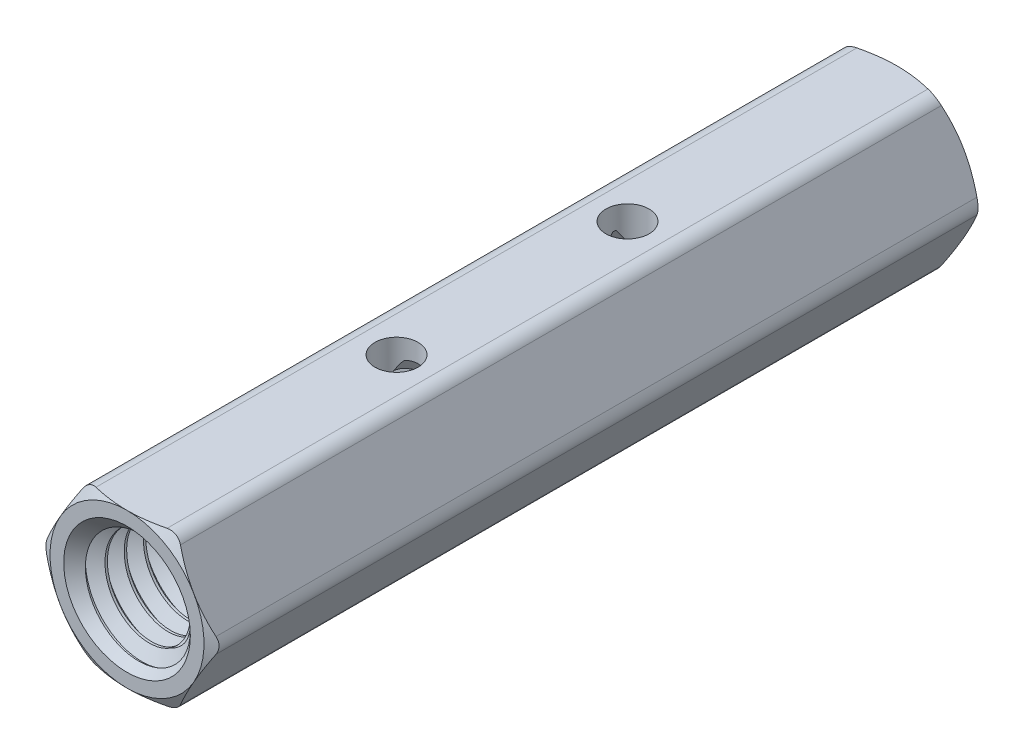
from build123d import *

# Parameters (mm, degrees)
SKETCH4_R                      = 2.794
BOSS_EXTRUDE1_DEPTH            = 15.875
SKETCH5_OUTSIDE_W              = 130.696
SKETCH5_OUTSIDE_H              = 129.714
SKETCH5_OUTSIDE_R              = 3.175
CUT_EXTRUDE1_DEPTH             = 33.11828075
CUT_EXTRUDE1_DRAFT             = -60
SKETCH6_OUTSIDE_W              = 130.696
SKETCH6_OUTSIDE_H              = 129.714
SKETCH6_OUTSIDE_R              = 3.175
CUT_EXTRUDE2_DEPTH             = 33.11828075
CUT_EXTRUDE2_DRAFT             = -60
FILLET1_R                      = 0.635
BOSS_EXTRUDE2_START            = -12.7
SKETCH7_R                      = 2.6114375
BOSS_EXTRUDE2_DEPTH            = 12.7
SKETCH8_W                      = 12.7
SKETCH8_H                      = 2.413
CUT_SWEEP1_PITCH               = 0.79375
CUT_SWEEP1_TO                  = 12.7
CIRPATTERN1_COUNT              = 2
SKETCH13_W                     = 0.889
SKETCH13_H                     = 3.175
F_0_CLEARANCE_HOLE1_AT_2_COUNT = 2
F_0_CLEARANCE_HOLE1_AT_2_PITCH = 9.525


with BuildPart() as part:
    # Sketch3 → Revolve1 (revolve)
    with BuildSketch(Plane(origin=(0, 0, 0), x_dir=(0, 0, -1), z_dir=(1, 0, 0))):
        Polygon((-15.6765625, 2.413), (-3.175, 2.413), (-3.175, 0), (3.175, 0), (3.175, 2.413), (15.875, 2.413), (15.875, 3.175), (0, 3.175), (-15.875, 3.175), (-15.875, 2.6114375), align=None)
        Polygon((-15.6765625, 2.413), (-3.175, 2.413), (-3.175, 0), (3.175, 0), (3.175, 2.413), (15.875, 2.413), (15.875, 3.175), (0, 3.175), (-15.875, 3.175), (-15.875, 2.6114375), align=None)
    revolve(axis=Axis((0, 0, 3.175), (0, 0, 1)))

    # Sketch4 → Boss-Extrude1 (add, symmetric)
    with BuildSketch(Plane.XY):
        Polygon((-1.833087105, 3.175), (-3.666174209, 0), (-1.833087105, -3.175), (1.833087105, -3.175), (3.666174209, 0), (1.833087105, 3.175), align=None)
        Circle(SKETCH4_R, mode=Mode.SUBTRACT)
    extrude(amount=BOSS_EXTRUDE1_DEPTH, both=True)


with BuildPart() as cut_extrude1_tool:
    # Sketch5 outside → Cut-Extrude1 (with draft: the straight prism first)
    with BuildSketch(Plane.XY.offset(15.875)):
        Rectangle(SKETCH5_OUTSIDE_W, SKETCH5_OUTSIDE_H)
        Circle(SKETCH5_OUTSIDE_R, mode=Mode.SUBTRACT)
    extrude(amount=-CUT_EXTRUDE1_DEPTH)
    # Cut-Extrude1: the draft: its side faces are tilted about the plane it starts from
    cut_extrude1_sides = [cut_extrude1_tool.faces().sort_by_distance(p)[0] for p in [
        (0, -64.857, -0.684140375),
        (65.348, 0, -0.684140375),
        (0, 64.857, -0.684140375),
        (-65.348, 0, -0.684140375),
        (-3.175, 0, -0.684140375),
    ]]
    draft(cut_extrude1_sides, Plane.XY.offset(15.875), CUT_EXTRUDE1_DRAFT)


with BuildPart() as part_1:
    add(part.part)

    # Cut-Extrude1: cut by cut_extrude1_tool
    add(cut_extrude1_tool.part, mode=Mode.SUBTRACT)


with BuildPart() as cut_extrude2_tool:
    # Sketch6 outside → Cut-Extrude2 (with draft: the straight prism first)
    with BuildSketch(Plane(origin=(0, 0, -15.875), x_dir=(-1, 0, 0), z_dir=(0, 0, -1))):
        Rectangle(SKETCH6_OUTSIDE_W, SKETCH6_OUTSIDE_H)
        Circle(SKETCH6_OUTSIDE_R, mode=Mode.SUBTRACT)
    extrude(amount=-CUT_EXTRUDE2_DEPTH)
    # Cut-Extrude2: the draft: its side faces are tilted about the plane it starts from
    cut_extrude2_sides = [cut_extrude2_tool.faces().sort_by_distance(p)[0] for p in [
        (0, -64.857, 0.684140375),
        (-65.348, 0, 0.684140375),
        (0, 64.857, 0.684140375),
        (65.348, 0, 0.684140375),
        (3.175, 0, 0.684140375),
    ]]
    draft(cut_extrude2_sides, Plane(origin=(0, 0, -15.875), x_dir=(-1, 0, 0), z_dir=(0, 0, -1)), CUT_EXTRUDE2_DRAFT)


with BuildPart() as part_2:
    add(part_1.part)

    # Cut-Extrude2: cut by cut_extrude2_tool
    add(cut_extrude2_tool.part, mode=Mode.SUBTRACT)

    # Fillet1
    fillet1_edges = [part_2.edges().sort_by_distance(p)[0] for p in [
        (1.833087105, 3.175, 0),
        (-3.666174209, 0, 0),
        (-1.833087105, -3.175, 0),
        (1.833087105, -3.175, 0),
        (3.666174209, 0, 0),
        (-1.833087105, 3.175, 0),
    ]]
    fillet(fillet1_edges, radius=FILLET1_R)

    # Split1
    split(bisect_by=Plane.XY, keep=Keep.TOP)

    # Sketch7 → Boss-Extrude2 (add)
    with BuildSketch(Plane(origin=(0, 0, 3.175), x_dir=(-1, 0, 0), z_dir=(0, 0, -1)).offset(BOSS_EXTRUDE2_START)):
        Circle(SKETCH7_R)
    extrude(amount=BOSS_EXTRUDE2_DEPTH)


with BuildPart() as body_2:
    # Sketch8 → Revolve2 (revolve)
    with BuildSketch(Plane(origin=(0, 0, 0), x_dir=(0, 0, -1), z_dir=(1, 0, 0))):
        with Locations((-9.525, 1.2065)):
            Rectangle(SKETCH8_W, SKETCH8_H)
    revolve(axis=Axis((0, 0, 3.175), (0, 0, 1)))

    # Cut-Sweep1: arcs per turn and ends read off the stored shape
    # Cut-Sweep1: the profile of Sketch10 screwed along a right-hand helix through 18 turns, 8 arcs to a turn; built about Z, then put on its axis
    cut_sweep1_z = Axis((0, 0, 0), (0, 0, 1))
    cut_sweep1_corners = [(1.897444252, 0, -1.190625), (1.897444252, 0, -1.09140625), (2.455962979, 0, -0.768945313), (2.455962979, 0, -1.513085938)]
    with BuildLine(mode=Mode.PRIVATE) as cut_sweep1_profile:
        Line(cut_sweep1_corners[0], cut_sweep1_corners[1])
        Line(cut_sweep1_corners[1], cut_sweep1_corners[2])
        Line(cut_sweep1_corners[2], cut_sweep1_corners[3])
        Line(cut_sweep1_corners[3], cut_sweep1_corners[0])
    cut_sweep1_cap = Face(cut_sweep1_profile.wire())
    cut_sweep1_turn_angles = [0, 22.5, 45, 67.5, 90, 112.5, 135, 157.5, 180, 202.5, 225, 247.5, 270, 292.5, 315, 337.5, 360]
    cut_sweep1_turn_weights = [1, 0.9238795325112867, 1, 0.9238795325112867, 1, 0.9238795325112867, 1, 0.9238795325112867, 1, 0.9238795325112867, 1, 0.9238795325112867, 1, 0.9238795325112867, 1, 0.9238795325112867, 1]
    cut_sweep1_turn_rails = [Edge.make_bspline([Vector(p[0], p[1], 0).rotate(cut_sweep1_z, cut_sweep1_turn_angles[k]) / cut_sweep1_turn_weights[k] + Vector(0, 0, p[2] + CUT_SWEEP1_PITCH * cut_sweep1_turn_angles[k] / 360) for k in range(17)], [0, 0, 0, 1, 1, 2, 2, 3, 3, 4, 4, 5, 5, 6, 6, 7, 7, 8, 8, 8], 2, cut_sweep1_turn_weights) for p in cut_sweep1_corners]
    cut_sweep1_turn_sides = [Face.make_surface_from_curves(cut_sweep1_turn_rails[p[0]], cut_sweep1_turn_rails[p[1]]) for p in [(0, 1), (1, 2), (2, 3), (3, 0)]]
    cut_sweep1 = Plane(origin=(0, 0, 15.875), x_dir=(0, 1, 0), z_dir=(0, 0, -1)) * split(Solid(Shell([*[p.moved(Location((0, 0, CUT_SWEEP1_PITCH * i))) for i in range(18) for p in cut_sweep1_turn_sides], cut_sweep1_cap, cut_sweep1_cap.rotate(cut_sweep1_z, 6480).moved(Location((0, 0, CUT_SWEEP1_PITCH * 6480 / 360)))])), bisect_by=Plane.XY.offset(CUT_SWEEP1_TO), keep=Keep.BOTTOM, mode=Mode.PRIVATE)
    add(cut_sweep1, mode=Mode.SUBTRACT)


with BuildPart() as part_3:
    add(part_2.part)

    # Combine1: cut body 2
    add(body_2.part, mode=Mode.SUBTRACT)

    # Cut-Extrude3 cone 1 section (through the dimple's axis) → Cut-Extrude3 (revolve, cut)
    with BuildSketch(Plane(origin=(0, 0, 15.875), x_dir=(0, -1, 0), z_dir=(1, 0, 0))):
        Polygon((0, 0), (2.6114375, 0), (0, 2.6114375), align=None)
    revolve(axis=Axis((0, 0, 15.875), (0, 0, -1)), mode=Mode.SUBTRACT)


with BuildPart() as cirpattern1_1:
    # CirPattern1: pattern copy
    add(part_3.part.rotate(Axis((0, 0, 0), (1, 0, 0)), 1 * 360 / CIRPATTERN1_COUNT))


with BuildPart() as part_4:
    add(part_3.part)

    # Combine2: union CirPattern1_1
    add(cirpattern1_1.part)

    # Sketch13 → #0 Clearance Hole1 (revolve, cut)
    with BuildSketch(Plane(origin=(0, 0, -4.7625), x_dir=(0, 0, -1), z_dir=(1, 0, 0))):
        with Locations((0.4445, 1.5875)):
            Rectangle(SKETCH13_W, SKETCH13_H)
    f_0_clearance_hole1 = revolve(axis=Axis((0, -6.35, -4.7625), (0, 1, 0)), mode=Mode.SUBTRACT)

    # #0 Clearance Hole1 at 2: #0 Clearance Hole1 ×2
    with Locations(*[(0, 0, i * F_0_CLEARANCE_HOLE1_AT_2_PITCH) for i in range(1, F_0_CLEARANCE_HOLE1_AT_2_COUNT)]):
        add(f_0_clearance_hole1, mode=Mode.SUBTRACT)


solid = part_4.part
